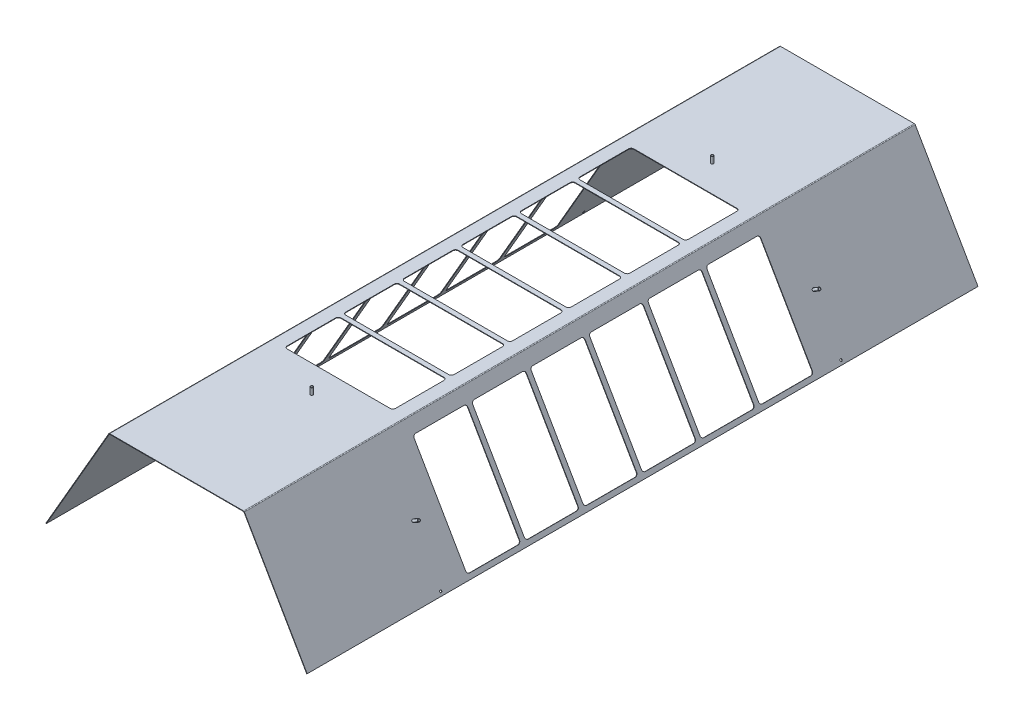
from build123d import *

# Parameters (mm, degrees)
EXTRUDE_1_DEPTH          = 985
SHEET_START              = -985
SHEET_METAL_1_DEPTH      = 1970
SHEET_METAL_1_2_DEPTH    = 1970
OTHER_START              = -343.410161514
OTHER_1_DEPTH            = 1.5
OTHER_START_2            = 341.910161514
OTHER_1_2_DEPTH          = 1.5
OTHER_1_3_DEPTH          = 1.5
SKETCH_2_R               = 4
EXTRUDE_1_2_DEPTH        = 20
SKETCH_3_R               = 4
EXTRUDE_2_DEPTH          = 20
CHAMFER_1_SIZE           = 1
CUT_EXTRUDE_1_REACH      = 1214.048
SKETCH_4_R               = 3
MIRROR_3_COPY_1_REACH    = 1214.048
MIRROR_3_COPY_1_SKETCH_R = 3


# Read off the part's stored shape, not the designer's step: Преобразовать-Твердое тело1, Полость1
with BuildPart() as part:
    # Sketch 1 → Extrude 1 (new, symmetric)
    with BuildSketch(Plane.XY):
        Polygon((382.154009929, 21.910161514), (197.401923789, 341.910161514), (-197.401923789, 341.910161514), (-382.154009929, 21.910161514), (-383.453048035, 22.660161514), (-198.267949192, 343.410161514), (198.267949192, 343.410161514), (383.453048035, 22.660161514), align=None)
    extrude(amount=EXTRUDE_1_DEPTH, both=True)

    # Sheet Metal 1 outline → Sheet Metal 1 (cut)
    with BuildSketch(Plane.XY.offset(SHEET_START)):
        with BuildLine():
            Line((198.267949192, 343.410161514), (196.535898385, 343.410161514))
            ThreePointArc((196.535898385, 343.410161514), (198.035898385, 343.008237725), (199.133974596, 341.910161514))
            Line((199.133974596, 341.910161514), (198.267949192, 343.410161514))
        make_face()
        with BuildLine():
            ThreePointArc((-199.133974596, 341.910161514), (-198.035898385, 343.008237725), (-196.535898385, 343.410161514))
            Line((-196.535898385, 343.410161514), (-198.267949192, 343.410161514))
            Line((-198.267949192, 343.410161514), (-199.133974596, 341.910161514))
        make_face()
    extrude(amount=SHEET_METAL_1_DEPTH, mode=Mode.SUBTRACT)

    # Sheet Metal 1 2 outline → Sheet Metal 1 2 (add)
    with BuildSketch(Plane.XY.offset(SHEET_START)):
        with BuildLine():
            Line((197.401923789, 341.910161514), (196.535898385, 341.910161514))
            ThreePointArc((196.535898385, 341.910161514), (197.285898385, 341.709199619), (197.834936491, 341.160161514))
            Line((197.834936491, 341.160161514), (197.401923789, 341.910161514))
        make_face()
        with BuildLine():
            ThreePointArc((-197.834936491, 341.160161514), (-197.285898385, 341.709199619), (-196.535898385, 341.910161514))
            Line((-196.535898385, 341.910161514), (-197.401923789, 341.910161514))
            Line((-197.401923789, 341.910161514), (-197.834936491, 341.160161514))
        make_face()
    extrude(amount=SHEET_METAL_1_2_DEPTH)

    # Полость1 outline → Полость1 (cut)
    with BuildSketch(Plane(origin=(0, 0, 0), x_dir=(0.5000000000000022, 0.8660254037844374, 0), z_dir=(0.8660254037844374, -0.5000000000000022, 0)).offset(OTHER_START)):
        with BuildLine():
            ThreePointArc((-151, -351), (-156.656854249, -353.343145751), (-159, -359))
            Line((-159, -359), (-159, -501))
            ThreePointArc((-159, -501), (-156.656854249, -506.656854249), (-151, -509))
            Line((-151, -509), (151, -509))
            ThreePointArc((151, -509), (156.65685425, -506.656854249), (159, -501))
            Line((159, -501), (159, -359))
            ThreePointArc((159, -359), (156.65685425, -353.343145751), (151, -351))
            Line((151, -351), (-151, -351))
        make_face()
        with BuildLine():
            Line((-159, -187), (-159, -329))
            ThreePointArc((-159, -329), (-156.656854249, -334.656854249), (-151, -337))
            Line((-151, -337), (151, -337))
            ThreePointArc((151, -337), (156.65685425, -334.656854249), (159, -329))
            Line((159, -329), (159, -187))
            ThreePointArc((159, -187), (156.65685425, -181.343145751), (151, -179))
            Line((151, -179), (-151, -179))
            ThreePointArc((-151, -179), (-156.656854249, -181.343145751), (-159, -187))
        make_face()
        with BuildLine():
            Line((-159, -15), (-159, -157))
            ThreePointArc((-159, -157), (-156.656854249, -162.656854249), (-151, -165))
            Line((-151, -165), (151, -165))
            ThreePointArc((151, -165), (156.65685425, -162.656854249), (159, -157))
            Line((159, -157), (159, -15))
            ThreePointArc((159, -15), (156.65685425, -9.34314575), (151, -7))
            Line((151, -7), (-151, -7))
            ThreePointArc((-151, -7), (-156.656854249, -9.343145751), (-159, -15))
        make_face()
        with BuildLine():
            Line((-159, 157), (-159, 15))
            ThreePointArc((-159, 15), (-156.656854249, 9.343145751), (-151, 7))
            Line((-151, 7), (151, 7))
            ThreePointArc((151, 7), (156.65685425, 9.34314575), (159, 15))
            Line((159, 15), (159, 157))
            ThreePointArc((159, 157), (156.65685425, 162.656854249), (151, 165))
            Line((151, 165), (-151, 165))
            ThreePointArc((-151, 165), (-156.656854249, 162.656854249), (-159, 157))
        make_face()
        with BuildLine():
            Line((-159, 329), (-159, 187))
            ThreePointArc((-159, 187), (-156.656854249, 181.343145751), (-151, 179))
            Line((-151, 179), (151, 179))
            ThreePointArc((151, 179), (156.65685425, 181.343145751), (159, 187))
            Line((159, 187), (159, 329))
            ThreePointArc((159, 329), (156.65685425, 334.656854249), (151, 337))
            Line((151, 337), (-151, 337))
            ThreePointArc((-151, 337), (-156.656854249, 334.656854249), (-159, 329))
        make_face()
        with BuildLine():
            Line((-159, 501), (-159, 359))
            ThreePointArc((-159, 359), (-156.656854249, 353.343145751), (-151, 351))
            Line((-151, 351), (151, 351))
            ThreePointArc((151, 351), (156.65685425, 353.343145751), (159, 359))
            Line((159, 359), (159, 501))
            ThreePointArc((159, 501), (156.65685425, 506.656854249), (151, 509))
            Line((151, 509), (-151, 509))
            ThreePointArc((-151, 509), (-156.656854249, 506.656854249), (-159, 501))
        make_face()
    extrude(amount=OTHER_1_DEPTH, mode=Mode.SUBTRACT)

    # Other 1 2 outline → Other 1 2 (cut)
    with BuildSketch(Plane(origin=(0, 0, 0), x_dir=(1, 0, 0), z_dir=(0, 1, 0)).offset(OTHER_START_2)):
        with BuildLine():
            Line((151, 509), (-151, 509))
            ThreePointArc((-151, 509), (-156.656854249, 506.656854249), (-159, 501))
            Line((-159, 501), (-159, 359))
            ThreePointArc((-159, 359), (-156.656854249, 353.343145751), (-151, 351))
            Line((-151, 351), (151, 351))
            ThreePointArc((151, 351), (156.656854249, 353.343145751), (159, 359))
            Line((159, 359), (159, 501))
            ThreePointArc((159, 501), (156.656854249, 506.656854249), (151, 509))
        make_face()
        with BuildLine():
            Line((151, 337), (-151, 337))
            ThreePointArc((-151, 337), (-156.656854249, 334.656854249), (-159, 329))
            Line((-159, 329), (-159, 187))
            ThreePointArc((-159, 187), (-156.656854249, 181.343145751), (-151, 179))
            Line((-151, 179), (151, 179))
            ThreePointArc((151, 179), (156.656854249, 181.343145751), (159, 187))
            Line((159, 187), (159, 329))
            ThreePointArc((159, 329), (156.656854249, 334.656854249), (151, 337))
        make_face()
        with BuildLine():
            Line((151, 165), (-151, 165))
            ThreePointArc((-151, 165), (-156.656854249, 162.656854249), (-159, 157))
            Line((-159, 157), (-159, 15))
            ThreePointArc((-159, 15), (-156.656854249, 9.343145751), (-151, 7))
            Line((-151, 7), (151, 7))
            ThreePointArc((151, 7), (156.656854249, 9.343145751), (159, 15))
            Line((159, 15), (159, 157))
            ThreePointArc((159, 157), (156.656854249, 162.656854249), (151, 165))
        make_face()
        with BuildLine():
            Line((151, -7), (-151, -7))
            ThreePointArc((-151, -7), (-156.656854249, -9.343145751), (-159, -15))
            Line((-159, -15), (-159, -157))
            ThreePointArc((-159, -157), (-156.656854249, -162.656854249), (-151, -165))
            Line((-151, -165), (151, -165))
            ThreePointArc((151, -165), (156.656854249, -162.656854249), (159, -157))
            Line((159, -157), (159, -15))
            ThreePointArc((159, -15), (156.656854249, -9.343145751), (151, -7))
        make_face()
        with BuildLine():
            Line((151, -179), (-151, -179))
            ThreePointArc((-151, -179), (-156.656854249, -181.343145751), (-159, -187))
            Line((-159, -187), (-159, -329))
            ThreePointArc((-159, -329), (-156.656854249, -334.656854249), (-151, -337))
            Line((-151, -337), (151, -337))
            ThreePointArc((151, -337), (156.656854249, -334.656854249), (159, -329))
            Line((159, -329), (159, -187))
            ThreePointArc((159, -187), (156.656854249, -181.343145751), (151, -179))
        make_face()
        with BuildLine():
            Line((151, -351), (-151, -351))
            ThreePointArc((-151, -351), (-156.656854249, -353.343145751), (-159, -359))
            Line((-159, -359), (-159, -501))
            ThreePointArc((-159, -501), (-156.656854249, -506.656854249), (-151, -509))
            Line((-151, -509), (151, -509))
            ThreePointArc((151, -509), (156.656854249, -506.656854249), (159, -501))
            Line((159, -501), (159, -359))
            ThreePointArc((159, -359), (156.656854249, -353.343145751), (151, -351))
        make_face()
    extrude(amount=OTHER_1_2_DEPTH, mode=Mode.SUBTRACT)

    # Other 1 3 outline → Other 1 3 (cut)
    with BuildSketch(Plane(origin=(0, 0, 0), x_dir=(0.5000000000000022, -0.8660254037844374, 0), z_dir=(0.8660254037844374, 0.5000000000000022, 0)).offset(OTHER_START_2)):
        with BuildLine():
            Line((151, 509), (-151, 509))
            ThreePointArc((-151, 509), (-156.65685425, 506.656854249), (-159, 501))
            Line((-159, 501), (-159, 359))
            ThreePointArc((-159, 359), (-156.65685425, 353.343145751), (-151, 351))
            Line((-151, 351), (151, 351))
            ThreePointArc((151, 351), (156.656854249, 353.343145751), (159, 359))
            Line((159, 359), (159, 501))
            ThreePointArc((159, 501), (156.656854249, 506.656854249), (151, 509))
        make_face()
        with BuildLine():
            Line((151, 337), (-151, 337))
            ThreePointArc((-151, 337), (-156.65685425, 334.656854249), (-159, 329))
            Line((-159, 329), (-159, 187))
            ThreePointArc((-159, 187), (-156.65685425, 181.343145751), (-151, 179))
            Line((-151, 179), (151, 179))
            ThreePointArc((151, 179), (156.656854249, 181.343145751), (159, 187))
            Line((159, 187), (159, 329))
            ThreePointArc((159, 329), (156.656854249, 334.656854249), (151, 337))
        make_face()
        with BuildLine():
            Line((151, 165), (-151, 165))
            ThreePointArc((-151, 165), (-156.65685425, 162.656854249), (-159, 157))
            Line((-159, 157), (-159, 15))
            ThreePointArc((-159, 15), (-156.65685425, 9.34314575), (-151, 7))
            Line((-151, 7), (151, 7))
            ThreePointArc((151, 7), (156.656854249, 9.343145751), (159, 15))
            Line((159, 15), (159, 157))
            ThreePointArc((159, 157), (156.656854249, 162.656854249), (151, 165))
        make_face()
        with BuildLine():
            Line((151, -7), (-151, -7))
            ThreePointArc((-151, -7), (-156.65685425, -9.34314575), (-159, -15))
            Line((-159, -15), (-159, -157))
            ThreePointArc((-159, -157), (-156.65685425, -162.656854249), (-151, -165))
            Line((-151, -165), (151, -165))
            ThreePointArc((151, -165), (156.656854249, -162.656854249), (159, -157))
            Line((159, -157), (159, -15))
            ThreePointArc((159, -15), (156.656854249, -9.343145751), (151, -7))
        make_face()
        with BuildLine():
            Line((151, -179), (-151, -179))
            ThreePointArc((-151, -179), (-156.65685425, -181.343145751), (-159, -187))
            Line((-159, -187), (-159, -329))
            ThreePointArc((-159, -329), (-156.65685425, -334.656854249), (-151, -337))
            Line((-151, -337), (151, -337))
            ThreePointArc((151, -337), (156.656854249, -334.656854249), (159, -329))
            Line((159, -329), (159, -187))
            ThreePointArc((159, -187), (156.656854249, -181.343145751), (151, -179))
        make_face()
        with BuildLine():
            Line((151, -351), (-151, -351))
            ThreePointArc((-151, -351), (-156.65685425, -353.343145751), (-159, -359))
            Line((-159, -359), (-159, -501))
            ThreePointArc((-159, -501), (-156.65685425, -506.656854249), (-151, -509))
            Line((-151, -509), (151, -509))
            ThreePointArc((151, -509), (156.656854249, -506.656854249), (159, -501))
            Line((159, -501), (159, -359))
            ThreePointArc((159, -359), (156.656854249, -353.343145751), (151, -351))
        make_face()
    extrude(amount=OTHER_1_3_DEPTH, mode=Mode.SUBTRACT)

    # Sketch 2 → Extrude 1 2 (add)
    with BuildSketch(Plane(origin=(0, 343.410161514, 0), x_dir=(1, 0, 0), z_dir=(0, 1, 0))):
        with Locations(Location((0, -588, 0), (0, 0, 90))):
            Circle(SKETCH_2_R)
        with Locations(Location((0, 588, 0), (0, 0, 90))):
            Circle(SKETCH_2_R)
    extrude(amount=EXTRUDE_1_2_DEPTH)

    # Эскиз3 → Бобышка-Вытянуть2 (add)
    with BuildSketch(Plane(origin=(-297.401923789, 171.705080757, 0), x_dir=(0, 0, 1), z_dir=(-0.8660254037844385, 0.5000000000000001, 0))):
        with Locations(Location((588, -1.299038106, 0), (0, 0, 90))):
            Circle(SKETCH_3_R)
        with Locations(Location((-588, -1.299038106, 0), (0, 0, 90))):
            Circle(SKETCH_3_R)
    extrude_2 = extrude(amount=EXTRUDE_2_DEPTH)

    # Зеркальное отражение1: Бобышка-Вытянуть2 across plane
    add(extrude_2.mirror(Plane(origin=(0, 0, 0), x_dir=(0, 0, 1), z_dir=(1, 0, 0))))

    # Фаска1
    chamfer_1_edges = [part.edges().sort_by_distance(p)[0] for p in [
        (0, 363.410161514, 592),
        (0, 363.410161514, -584),
        (-317.371950917, 177.115979142, -588),
        (-317.371950917, 177.115979142, 588),
        (317.371950917, 177.115979142, -588),
        (317.371950917, 177.115979142, 588),
    ]]
    chamfer(chamfer_1_edges, length=CHAMFER_1_SIZE)

    # Эскиз4 → Вырез-Вытянуть1 (cut, up to next)
    with BuildSketch(Plane(origin=(296.102885683, 170.955080757, 0), x_dir=(0, 0, 1), z_dir=(-0.8660254037844385, -0.5000000000000004, 0)), mode=Mode.PRIVATE) as cut_extrude_1_sk1:
        with Locations(Location((-588, -162.102248493, 0), (0, 0, 270))):
            Circle(SKETCH_4_R)
    cut_extrude_1_tool1 = extrude(cut_extrude_1_sk1.sketch, amount=-CUT_EXTRUDE_1_REACH, mode=Mode.PRIVATE) & part.part
    cut_extrude_1 = cut_extrude_1_tool1.solids().sort_by_distance((377.15401, 30.570416, -588))[0]
    add(cut_extrude_1, mode=Mode.SUBTRACT)

    # Зеркальное отражение2: Вырез-Вытянуть1 across plane
    add(cut_extrude_1.mirror(Plane.XY), mode=Mode.SUBTRACT)

    # Зеркальное отражение3: Вырез-Вытянуть1 across plane
    add(cut_extrude_1.mirror(Plane(origin=(0, 0, 0), x_dir=(0, 0, 1), z_dir=(1, 0, 0))), mode=Mode.SUBTRACT)

    # Зеркальное отражение3 copy 1 sketch → Зеркальное отражение3 copy 1 (cut, up to next)
    with BuildSketch(Plane(origin=(-296.102885683, 170.955080757, 0), x_dir=(0, 0, -1), z_dir=(0.8660254037844385, -0.5000000000000004, 0)), mode=Mode.PRIVATE) as mirror_3_copy_1_sk1:
        with Locations(Location((-588, -162.102248493, 0), (0, 0, 270))):
            Circle(MIRROR_3_COPY_1_SKETCH_R)
    mirror_3_copy_1_tool1 = extrude(mirror_3_copy_1_sk1.sketch, amount=-MIRROR_3_COPY_1_REACH, mode=Mode.PRIVATE) & part.part
    add(mirror_3_copy_1_tool1.solids().sort_by_distance((-377.15401, 30.570416, 588))[0], mode=Mode.SUBTRACT)


solid = part.part
